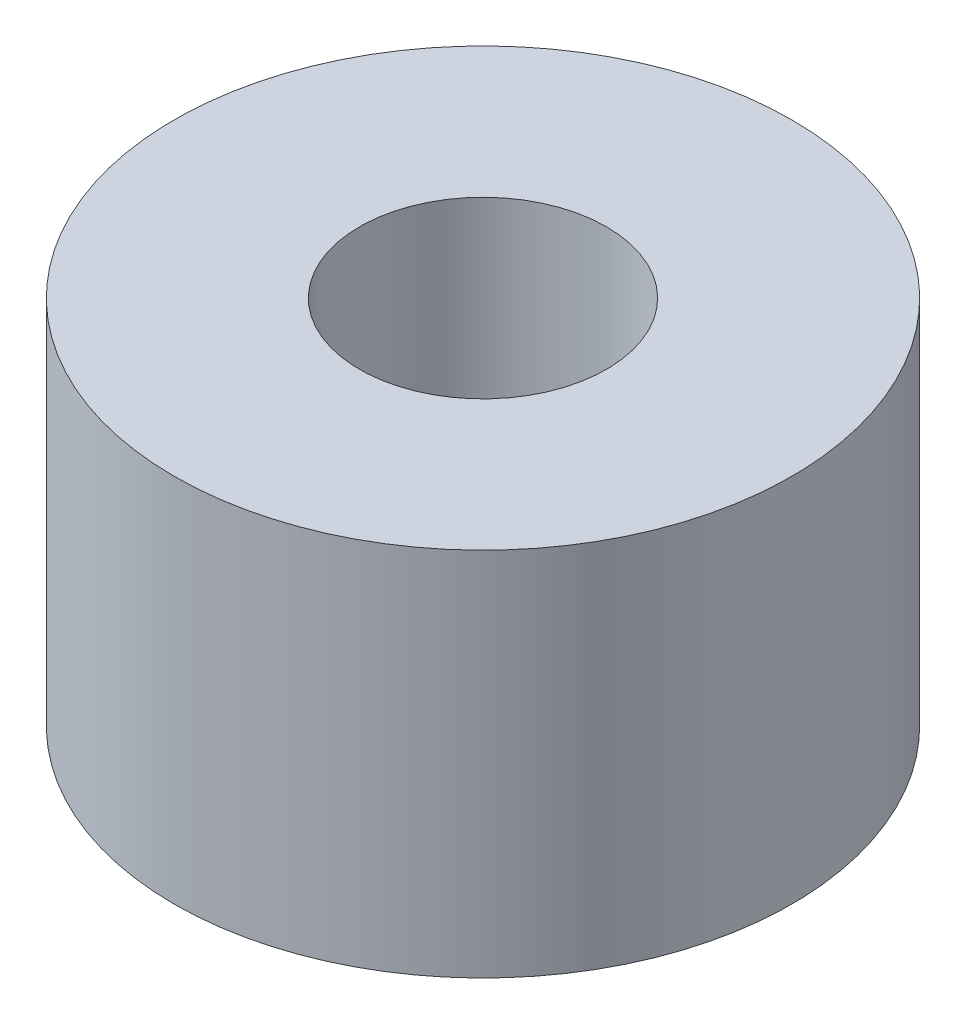
from build123d import *

# Parameters (mm, degrees)
SKETCH1_W = 4.5
SKETCH1_H = 9


with BuildPart() as part:
    # Sketch1 → Revolve1 (revolve)
    with BuildSketch(Plane.XY):
        with Locations((5.25, 4.5)):
            Rectangle(SKETCH1_W, SKETCH1_H)
    revolve(axis=Axis((0, 0, 0), (0, 1, 0)))


solid = part.part
